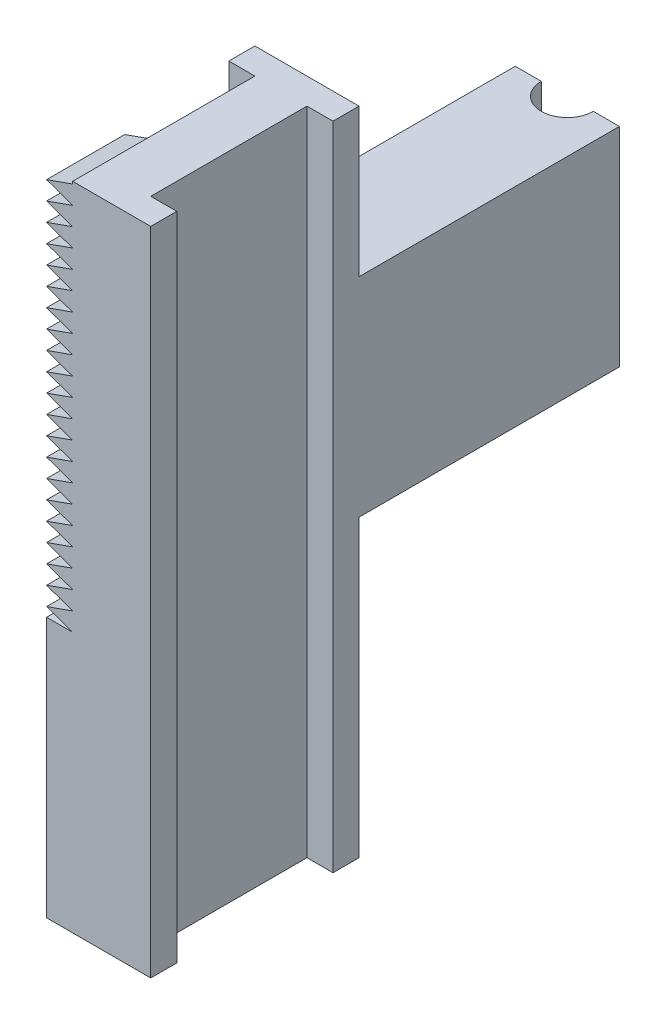
from build123d import *

# Parameters (mm, degrees)
BOSS_EXTRUDE1_DEPTH = 25
SKETCH2_W           = 1
SKETCH2_H           = 1
CUT_EXTRUDE1_DEPTH  = 15
BOSS_EXTRUDE2_DEPTH = 3
LPATTERN1_COUNT     = 21
LPATTERN1_PITCH     = 0.71
SKETCH4_W           = 4
SKETCH4_H           = 8
BOSS_EXTRUDE3_DEPTH = 10
SKETCH5_R           = 1
CUT_EXTRUDE2_DEPTH  = 7


with BuildPart() as part:
    # Sketch1 → Boss-Extrude1 (new body)
    with BuildSketch(Plane(origin=(0, 0, 0), x_dir=(1, 0, 0), z_dir=(0, 1, 0))):
        Polygon((2, 4), (-2, 4), (-2, 3), (-1, 3), (-1, 0), (1, 0), (1, 3), (2, 3), align=None)
    boss_extrude1 = extrude(amount=BOSS_EXTRUDE1_DEPTH)

    # Mirror1: Boss-Extrude1 across plane
    add(boss_extrude1.mirror(Plane(origin=(-1, 25, 0), x_dir=(1, 0, 0), z_dir=(0, 0, -1))))

    # Sketch2 → Cut-Extrude1 (cut)
    with BuildSketch(Plane(origin=(0, 25, 0), x_dir=(1, 0, 0), z_dir=(0, 1, 0))):
        with Locations((-1.5, -3.5)):
            Rectangle(SKETCH2_W, SKETCH2_H)
    extrude(amount=-CUT_EXTRUDE1_DEPTH, mode=Mode.SUBTRACT)

    # Sketch3 → Boss-Extrude2 (add)
    with BuildSketch(Plane.XY.offset(4)):
        Polygon((-1, 10), (-2, 10.355), (-1, 10.71), align=None)
    boss_extrude2 = extrude(amount=-BOSS_EXTRUDE2_DEPTH)

    # LPattern1: Boss-Extrude2 ×21
    with Locations(*[(0, i * LPATTERN1_PITCH, 0) for i in range(1, LPATTERN1_COUNT)]):
        add(boss_extrude2)

    # Sketch4 → Boss-Extrude3 (add)
    with BuildSketch(Plane(origin=(0, 0, -4), x_dir=(-1, 0, 0), z_dir=(0, 0, -1))):
        with Locations((0, 15.326035003)):
            Rectangle(SKETCH4_W, SKETCH4_H)
    extrude(amount=BOSS_EXTRUDE3_DEPTH)

    # Sketch5 → Cut-Extrude2 (cut)
    with BuildSketch(Plane(origin=(0, 19.326035003, 0), x_dir=(1, 0, 0), z_dir=(0, 1, 0))):
        with Locations((0, 14)):
            Circle(SKETCH5_R)
    extrude(amount=-CUT_EXTRUDE2_DEPTH, mode=Mode.SUBTRACT)


solid = part.part
